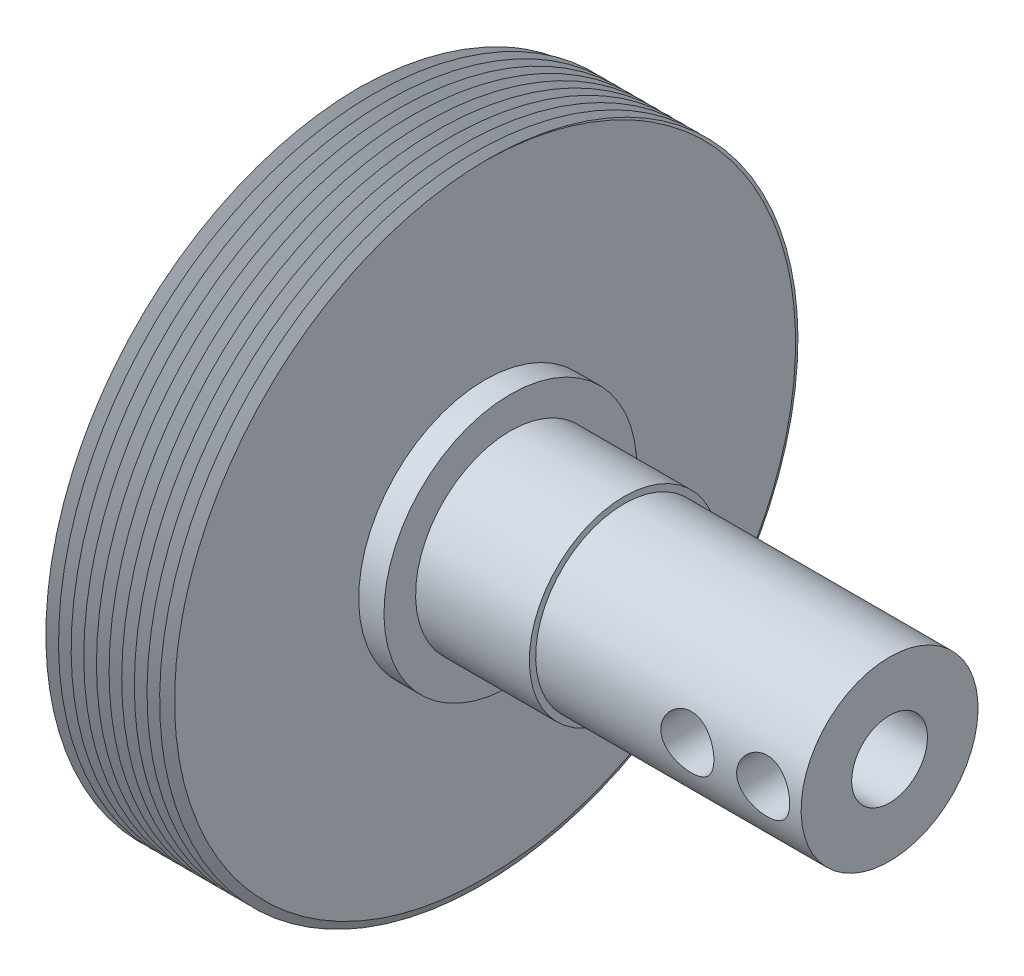
from build123d import *

# Parameters (mm, degrees)
CUT_SWEEP1_PITCH          = 1
M5X0_8_TAPPED_HOLE1_D     = 4.2
M5X0_8_TAPPED_HOLE1_DEPTH = 7
M5X0_8_TAPPED_HOLE1_TIP   = 1.2618073


with BuildPart() as part:
    # Sketch1 → Revolve1 (revolve)
    with BuildSketch(Plane.XY):
        Polygon((0, 0), (0, 25), (10, 25), (10, 10), (12, 10), (12, 7.5), (21, 7.5), (21, 7), (42, 7), (42, 3), (30, 3), (28.197418143, 0), align=None)
    revolve(axis=Axis((28.197418143, 0, 0), (-1, 0, 0)))

    # Cut-Sweep1: the profile of Sketch2 screwed along a right-hand helix of 50 turns, 8 arcs to a turn; built about Z, then put on its axis
    cut_sweep1_z = Axis((0, 0, 0), (0, 0, 1))
    cut_sweep1_corners = [(25, 0, 0), (24.133974596, 0, -0.5), (25, 0, -1), (26, 0, -1), (26, 0, 0)]
    with BuildLine(mode=Mode.PRIVATE) as cut_sweep1_profile:
        Line(cut_sweep1_corners[0], cut_sweep1_corners[1])
        Line(cut_sweep1_corners[1], cut_sweep1_corners[2])
        Line(cut_sweep1_corners[2], cut_sweep1_corners[3])
        Line(cut_sweep1_corners[3], cut_sweep1_corners[4])
        Line(cut_sweep1_corners[4], cut_sweep1_corners[0])
    cut_sweep1_cap = Face(cut_sweep1_profile.wire())
    cut_sweep1_turn_angles = [0, 22.5, 45, 67.5, 90, 112.5, 135, 157.5, 180, 202.5, 225, 247.5, 270, 292.5, 315, 337.5, 360]
    cut_sweep1_turn_weights = [1, 0.9238795325112867, 1, 0.9238795325112867, 1, 0.9238795325112867, 1, 0.9238795325112867, 1, 0.9238795325112867, 1, 0.9238795325112867, 1, 0.9238795325112867, 1, 0.9238795325112867, 1]
    cut_sweep1_turn_rails = [Edge.make_bspline([Vector(p[0], p[1], 0).rotate(cut_sweep1_z, cut_sweep1_turn_angles[k]) / cut_sweep1_turn_weights[k] + Vector(0, 0, p[2] + CUT_SWEEP1_PITCH * cut_sweep1_turn_angles[k] / 360) for k in range(17)], [0, 0, 0, 1, 1, 2, 2, 3, 3, 4, 4, 5, 5, 6, 6, 7, 7, 8, 8, 8], 2, cut_sweep1_turn_weights) for p in cut_sweep1_corners]
    cut_sweep1_turn_sides = [Face.make_surface_from_curves(cut_sweep1_turn_rails[p[0]], cut_sweep1_turn_rails[p[1]]) for p in [(0, 1), (1, 2), (2, 3), (3, 4), (4, 0)]]
    cut_sweep1_turn = Solid(Shell([*cut_sweep1_turn_sides, cut_sweep1_cap, cut_sweep1_cap.rotate(cut_sweep1_z, 360).moved(Location((0, 0, CUT_SWEEP1_PITCH * 360 / 360)))]))
    cut_sweep1_each = [*[cut_sweep1_turn.moved(Location((0, 0, CUT_SWEEP1_PITCH * i))) for i in range(50)]]
    add(Plane(origin=(0, 0, 0), x_dir=(0, 1, 0), z_dir=(1, 0, 0)) * Compound([cut_sweep1_each[i] for i in range(0, 50, 2)]), mode=Mode.SUBTRACT)
    add(Plane(origin=(0, 0, 0), x_dir=(0, 1, 0), z_dir=(1, 0, 0)) * Compound([cut_sweep1_each[i] for i in range(1, 50, 2)]), mode=Mode.SUBTRACT)

    # M5x0.8 Tapped Hole1
    with Locations(Plane.XY.offset(7)):
        with Locations((39, 0), (33, 0)):
            Hole(M5X0_8_TAPPED_HOLE1_D / 2, depth=M5X0_8_TAPPED_HOLE1_DEPTH)
            with Locations((0, 0, -(M5X0_8_TAPPED_HOLE1_DEPTH + M5X0_8_TAPPED_HOLE1_TIP / 2))):  # 118° drill point
                Cone(0, M5X0_8_TAPPED_HOLE1_D / 2, M5X0_8_TAPPED_HOLE1_TIP, mode=Mode.SUBTRACT)


solid = part.part
